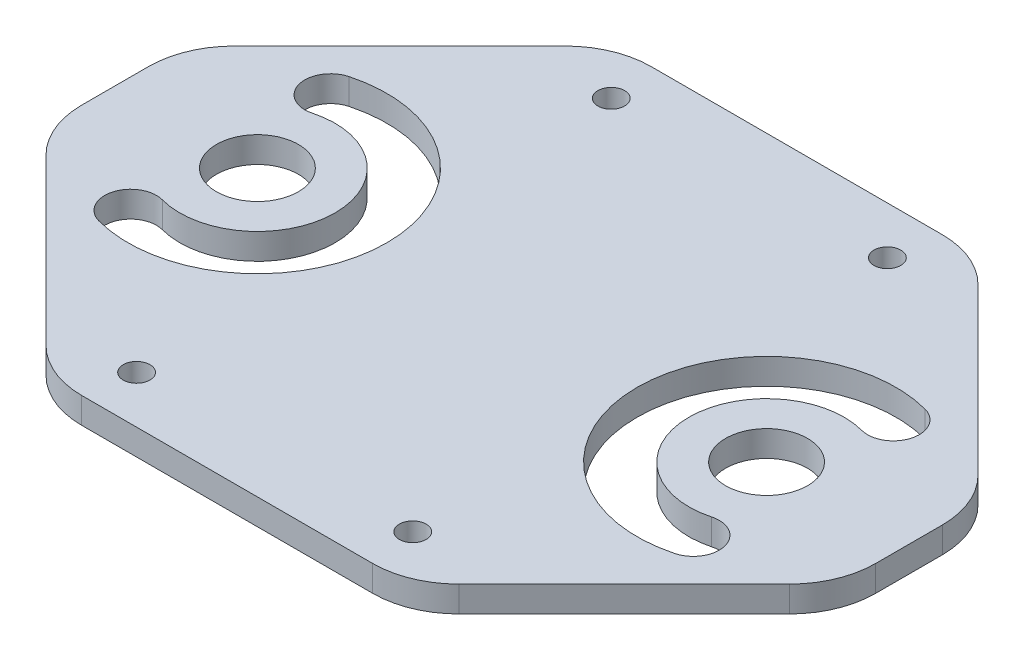
from build123d import *

# Parameters (mm, degrees)
SKETCH_1_W               = 92
SKETCH_1_H               = 66
SKETCH_1_R               = 1.55
EXTRUDE_1_DEPTH          = 3
CHAMFER_1_SIZE           = 25
CUT_EXTRUDE_1_DEPTH      = 57.692151132
CUT_EXTRUDE_1_DEPTH_BACK = 57.692151132
SKETCH_3_R               = 4.75
FILLET_1_R               = 10


with BuildPart() as part:
    # 草图1 → 凸台-拉伸1 (new body)
    with BuildSketch(Plane(origin=(0, 0, 0), x_dir=(1, 0, 0), z_dir=(0, 1, 0))):
        Rectangle(SKETCH_1_W, SKETCH_1_H)
        with Locations((-16, 27.5)):
            Circle(SKETCH_1_R, mode=Mode.SUBTRACT)
        with Locations((16, 27.5)):
            Circle(SKETCH_1_R, mode=Mode.SUBTRACT)
        with Locations((16, -27.5)):
            Circle(SKETCH_1_R, mode=Mode.SUBTRACT)
        with Locations((-16, -27.5)):
            Circle(SKETCH_1_R, mode=Mode.SUBTRACT)
    extrude(amount=EXTRUDE_1_DEPTH)

    # 倒角1
    chamfer_1_edges = [part.edges().sort_by_distance(p)[0] for p in [
        (-46, 1.5, 33),
        (46, 1.5, 33),
        (46, 1.5, -33),
        (-46, 1.5, -33),
    ]]
    chamfer(chamfer_1_edges, length=CHAMFER_1_SIZE)

    # 草图3 → 切除-拉伸1 (cut, two sides: drawn at the far end of the back side and taken through both)
    with BuildSketch(Plane(origin=(0, 3, 0), x_dir=(1, 0, 0), z_dir=(0, 1, 0)).offset(-CUT_EXTRUDE_1_DEPTH_BACK)):
        with Locations((-29.5, 0)):
            Circle(SKETCH_3_R)
        with Locations((29.5, 0)):
            Circle(SKETCH_3_R)
        with BuildLine():
            ThreePointArc((-31.829371406, -8.693332437), (-35.50360602, -10.81465278), (-33.382285677, -14.488887394))
            ThreePointArc((-33.382285677, -14.488887394), (-14.5, 0), (-33.382285677, 14.488887394))
            ThreePointArc((-33.382285677, 14.488887394), (-35.50360602, 10.81465278), (-31.829371406, 8.693332437))
            ThreePointArc((-31.829371406, 8.693332437), (-20.5, 0), (-31.829371406, -8.693332437))
        make_face()
        with BuildLine():
            ThreePointArc((33.382285677, 14.488887394), (14.5, 0), (33.382285677, -14.488887394))
            ThreePointArc((33.382285677, -14.488887394), (35.50360602, -10.81465278), (31.829371406, -8.693332437))
            ThreePointArc((31.829371406, -8.693332437), (20.5, 0), (31.829371406, 8.693332437))
            ThreePointArc((31.829371406, 8.693332437), (35.50360602, 10.81465278), (33.382285677, 14.488887394))
        make_face()
    extrude(amount=CUT_EXTRUDE_1_DEPTH + CUT_EXTRUDE_1_DEPTH_BACK, mode=Mode.SUBTRACT)

    # 圆角1
    fillet_1_edges = [part.edges().sort_by_distance(p)[0] for p in [
        (21, 1.5, -33),
        (46, 1.5, -8),
        (46, 1.5, 8),
        (21, 1.5, 33),
        (-21, 1.5, 33),
        (-46, 1.5, 8),
        (-46, 1.5, -8),
        (-21, 1.5, -33),
    ]]
    fillet(fillet_1_edges, radius=FILLET_1_R)


solid = part.part
